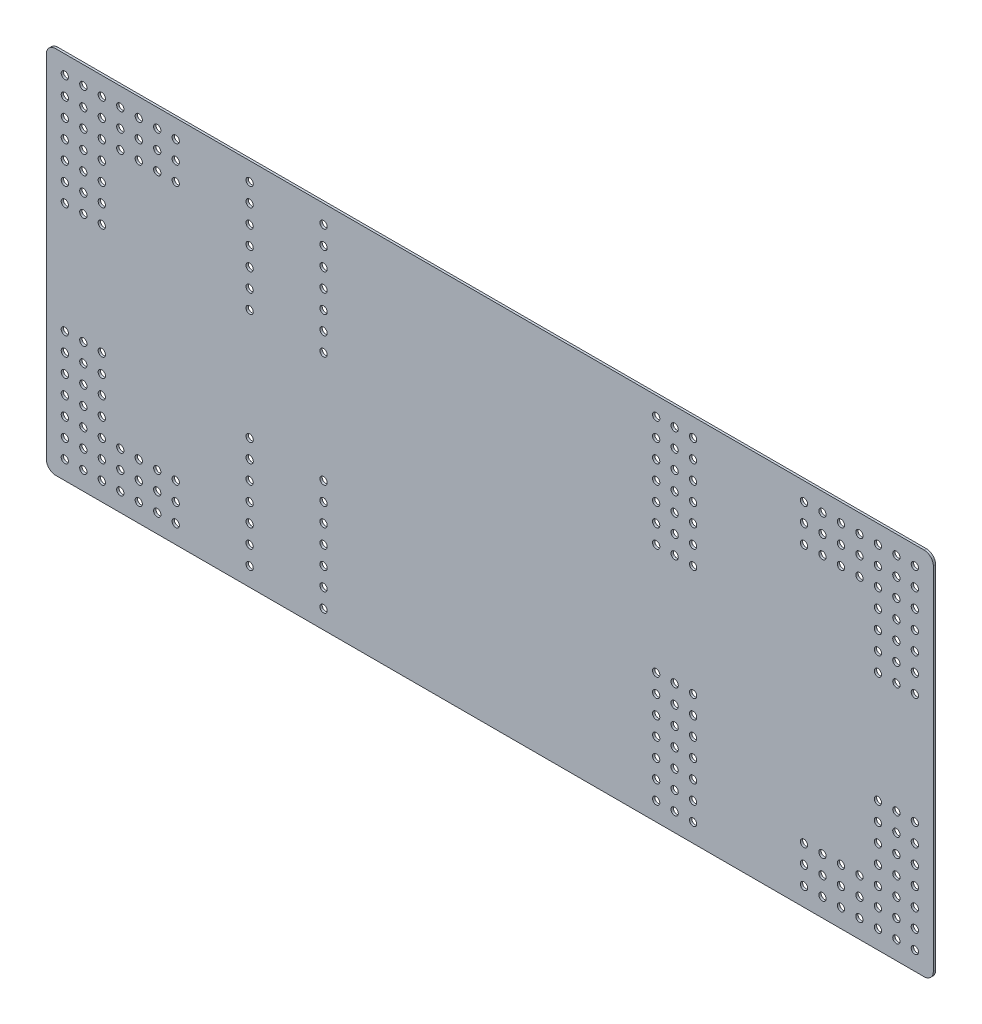
from build123d import *

# Parameters (mm, degrees)
BOSS_EXTRUDE1_DEPTH = 1.5875
SKETCH2_R           = 2.5
CUT_EXTRUDE1_DEPTH  = 474.010623106


with BuildPart() as part:
    # Sketch1 → Boss-Extrude1 (new body)
    with BuildSketch(Plane.XY):
        with BuildLine():
            Line((-148.965673289, 122.233995585), (447.934326711, 122.233995585))
            ThreePointArc((447.934326711, 122.233995585), (452.424454771, 120.374123646), (454.284326711, 115.883995585))
            Line((454.284326711, 115.883995585), (454.284326711, -125.416004415))
            ThreePointArc((454.284326711, -125.416004415), (452.424454771, -129.906132476), (447.934326711, -131.766004415))
            Line((447.934326711, -131.766004415), (-148.965673289, -131.766004415))
            ThreePointArc((-148.965673289, -131.766004415), (-153.45580135, -129.906132476), (-155.315673289, -125.416004415))
            Line((-155.315673289, -125.416004415), (-155.315673289, 115.883995585))
            ThreePointArc((-155.315673289, 115.883995585), (-153.45580135, 120.374123646), (-148.965673289, 122.233995585))
        make_face()
    extrude(amount=BOSS_EXTRUDE1_DEPTH)

    # Sketch2 → Cut-Extrude1 (cut, through all)
    with BuildSketch(Plane.XY.offset(1.5875)):
        with Locations((-142.615673289, 109.533995585)):
            Circle(SKETCH2_R)
        with Locations((-129.915673289, 109.533995585)):
            Circle(SKETCH2_R)
        with Locations((-117.215673289, 109.533995585)):
            Circle(SKETCH2_R)
        with Locations((-104.515673289, 109.533995585)):
            Circle(SKETCH2_R)
        with Locations((-91.815673289, 109.533995585)):
            Circle(SKETCH2_R)
        with Locations((-79.115673289, 109.533995585)):
            Circle(SKETCH2_R)
        with Locations((-66.415673289, 109.533995585)):
            Circle(SKETCH2_R)
        with Locations((-129.915673289, 96.833995585)):
            Circle(SKETCH2_R)
        with Locations((-117.215673289, 96.833995585)):
            Circle(SKETCH2_R)
        with Locations((-104.515673289, 96.833995585)):
            Circle(SKETCH2_R)
        with Locations((-91.815673289, 96.833995585)):
            Circle(SKETCH2_R)
        with Locations((-79.115673289, 96.833995585)):
            Circle(SKETCH2_R)
        with Locations((-66.415673289, 96.833995585)):
            Circle(SKETCH2_R)
        with Locations((-129.915673289, 84.133995585)):
            Circle(SKETCH2_R)
        with Locations((-117.215673289, 84.133995585)):
            Circle(SKETCH2_R)
        with Locations((-104.515673289, 84.133995585)):
            Circle(SKETCH2_R)
        with Locations((-91.815673289, 84.133995585)):
            Circle(SKETCH2_R)
        with Locations((-79.115673289, 84.133995585)):
            Circle(SKETCH2_R)
        with Locations((-66.415673289, 84.133995585)):
            Circle(SKETCH2_R)
        with Locations((-142.615673289, 96.833995585)):
            Circle(SKETCH2_R)
        with Locations((-142.615673289, 84.133995585)):
            Circle(SKETCH2_R)
        with Locations((-142.615673289, 71.433995585)):
            Circle(SKETCH2_R)
        with Locations((-129.915673289, 71.433995585)):
            Circle(SKETCH2_R)
        with Locations((-117.215673289, 71.433995585)):
            Circle(SKETCH2_R)
        with Locations((-129.915673289, 58.733995585)):
            Circle(SKETCH2_R)
        with Locations((-117.215673289, 58.733995585)):
            Circle(SKETCH2_R)
        with Locations((-129.915673289, 46.033995585)):
            Circle(SKETCH2_R)
        with Locations((-117.215673289, 46.033995585)):
            Circle(SKETCH2_R)
        with Locations((-129.915673289, 33.333995585)):
            Circle(SKETCH2_R)
        with Locations((-117.215673289, 33.333995585)):
            Circle(SKETCH2_R)
        with Locations((-142.615673289, 58.733995585)):
            Circle(SKETCH2_R)
        with Locations((-142.615673289, 46.033995585)):
            Circle(SKETCH2_R)
        with Locations((-142.615673289, 33.333995585)):
            Circle(SKETCH2_R)
        with Locations((-142.615673289, -42.866004415)):
            Circle(SKETCH2_R)
        with Locations((-142.615673289, -55.566004415)):
            Circle(SKETCH2_R)
        with Locations((-142.615673289, -68.266004415)):
            Circle(SKETCH2_R)
        with Locations((-117.215673289, -42.866004415)):
            Circle(SKETCH2_R)
        with Locations((-129.915673289, -42.866004415)):
            Circle(SKETCH2_R)
        with Locations((-117.215673289, -55.566004415)):
            Circle(SKETCH2_R)
        with Locations((-129.915673289, -55.566004415)):
            Circle(SKETCH2_R)
        with Locations((-117.215673289, -68.266004415)):
            Circle(SKETCH2_R)
        with Locations((-129.915673289, -68.266004415)):
            Circle(SKETCH2_R)
        with Locations((-117.215673289, -80.966004415)):
            Circle(SKETCH2_R)
        with Locations((-129.915673289, -80.966004415)):
            Circle(SKETCH2_R)
        with Locations((-142.615673289, -80.966004415)):
            Circle(SKETCH2_R)
        with Locations((-142.615673289, -93.666004415)):
            Circle(SKETCH2_R)
        with Locations((-142.615673289, -106.366004415)):
            Circle(SKETCH2_R)
        with Locations((-66.415673289, -93.666004415)):
            Circle(SKETCH2_R)
        with Locations((-79.115673289, -93.666004415)):
            Circle(SKETCH2_R)
        with Locations((-91.815673289, -93.666004415)):
            Circle(SKETCH2_R)
        with Locations((-104.515673289, -93.666004415)):
            Circle(SKETCH2_R)
        with Locations((-117.215673289, -93.666004415)):
            Circle(SKETCH2_R)
        with Locations((-129.915673289, -93.666004415)):
            Circle(SKETCH2_R)
        with Locations((-66.415673289, -106.366004415)):
            Circle(SKETCH2_R)
        with Locations((-79.115673289, -106.366004415)):
            Circle(SKETCH2_R)
        with Locations((-91.815673289, -106.366004415)):
            Circle(SKETCH2_R)
        with Locations((-104.515673289, -106.366004415)):
            Circle(SKETCH2_R)
        with Locations((-117.215673289, -106.366004415)):
            Circle(SKETCH2_R)
        with Locations((-129.915673289, -106.366004415)):
            Circle(SKETCH2_R)
        with Locations((-66.415673289, -119.066004415)):
            Circle(SKETCH2_R)
        with Locations((-79.115673289, -119.066004415)):
            Circle(SKETCH2_R)
        with Locations((-91.815673289, -119.066004415)):
            Circle(SKETCH2_R)
        with Locations((-104.515673289, -119.066004415)):
            Circle(SKETCH2_R)
        with Locations((-117.215673289, -119.066004415)):
            Circle(SKETCH2_R)
        with Locations((-129.915673289, -119.066004415)):
            Circle(SKETCH2_R)
        with Locations((-142.615673289, -119.066004415)):
            Circle(SKETCH2_R)
        with Locations((441.584326711, -119.066004415)):
            Circle(SKETCH2_R)
        with Locations((428.884326711, -119.066004415)):
            Circle(SKETCH2_R)
        with Locations((416.184326711, -119.066004415)):
            Circle(SKETCH2_R)
        with Locations((403.484326711, -119.066004415)):
            Circle(SKETCH2_R)
        with Locations((390.784326711, -119.066004415)):
            Circle(SKETCH2_R)
        with Locations((378.084326711, -119.066004415)):
            Circle(SKETCH2_R)
        with Locations((365.384326711, -119.066004415)):
            Circle(SKETCH2_R)
        with Locations((428.884326711, -106.366004415)):
            Circle(SKETCH2_R)
        with Locations((416.184326711, -106.366004415)):
            Circle(SKETCH2_R)
        with Locations((403.484326711, -106.366004415)):
            Circle(SKETCH2_R)
        with Locations((390.784326711, -106.366004415)):
            Circle(SKETCH2_R)
        with Locations((378.084326711, -106.366004415)):
            Circle(SKETCH2_R)
        with Locations((365.384326711, -106.366004415)):
            Circle(SKETCH2_R)
        with Locations((428.884326711, -93.666004415)):
            Circle(SKETCH2_R)
        with Locations((416.184326711, -93.666004415)):
            Circle(SKETCH2_R)
        with Locations((403.484326711, -93.666004415)):
            Circle(SKETCH2_R)
        with Locations((390.784326711, -93.666004415)):
            Circle(SKETCH2_R)
        with Locations((378.084326711, -93.666004415)):
            Circle(SKETCH2_R)
        with Locations((365.384326711, -93.666004415)):
            Circle(SKETCH2_R)
        with Locations((441.584326711, -106.366004415)):
            Circle(SKETCH2_R)
        with Locations((441.584326711, -93.666004415)):
            Circle(SKETCH2_R)
        with Locations((441.584326711, -80.966004415)):
            Circle(SKETCH2_R)
        with Locations((428.884326711, -80.966004415)):
            Circle(SKETCH2_R)
        with Locations((416.184326711, -80.966004415)):
            Circle(SKETCH2_R)
        with Locations((428.884326711, -68.266004415)):
            Circle(SKETCH2_R)
        with Locations((416.184326711, -68.266004415)):
            Circle(SKETCH2_R)
        with Locations((428.884326711, -55.566004415)):
            Circle(SKETCH2_R)
        with Locations((416.184326711, -55.566004415)):
            Circle(SKETCH2_R)
        with Locations((428.884326711, -42.866004415)):
            Circle(SKETCH2_R)
        with Locations((416.184326711, -42.866004415)):
            Circle(SKETCH2_R)
        with Locations((441.584326711, -68.266004415)):
            Circle(SKETCH2_R)
        with Locations((441.584326711, -55.566004415)):
            Circle(SKETCH2_R)
        with Locations((441.584326711, -42.866004415)):
            Circle(SKETCH2_R)
        with Locations((441.584326711, 33.333995585)):
            Circle(SKETCH2_R)
        with Locations((441.584326711, 46.033995585)):
            Circle(SKETCH2_R)
        with Locations((441.584326711, 58.733995585)):
            Circle(SKETCH2_R)
        with Locations((416.184326711, 33.333995585)):
            Circle(SKETCH2_R)
        with Locations((428.884326711, 33.333995585)):
            Circle(SKETCH2_R)
        with Locations((416.184326711, 46.033995585)):
            Circle(SKETCH2_R)
        with Locations((428.884326711, 46.033995585)):
            Circle(SKETCH2_R)
        with Locations((416.184326711, 58.733995585)):
            Circle(SKETCH2_R)
        with Locations((428.884326711, 58.733995585)):
            Circle(SKETCH2_R)
        with Locations((416.184326711, 71.433995585)):
            Circle(SKETCH2_R)
        with Locations((428.884326711, 71.433995585)):
            Circle(SKETCH2_R)
        with Locations((441.584326711, 71.433995585)):
            Circle(SKETCH2_R)
        with Locations((441.584326711, 84.133995585)):
            Circle(SKETCH2_R)
        with Locations((441.584326711, 96.833995585)):
            Circle(SKETCH2_R)
        with Locations((365.384326711, 84.133995585)):
            Circle(SKETCH2_R)
        with Locations((378.084326711, 84.133995585)):
            Circle(SKETCH2_R)
        with Locations((390.784326711, 84.133995585)):
            Circle(SKETCH2_R)
        with Locations((403.484326711, 84.133995585)):
            Circle(SKETCH2_R)
        with Locations((416.184326711, 84.133995585)):
            Circle(SKETCH2_R)
        with Locations((428.884326711, 84.133995585)):
            Circle(SKETCH2_R)
        with Locations((365.384326711, 96.833995585)):
            Circle(SKETCH2_R)
        with Locations((378.084326711, 96.833995585)):
            Circle(SKETCH2_R)
        with Locations((390.784326711, 96.833995585)):
            Circle(SKETCH2_R)
        with Locations((403.484326711, 96.833995585)):
            Circle(SKETCH2_R)
        with Locations((416.184326711, 96.833995585)):
            Circle(SKETCH2_R)
        with Locations((428.884326711, 96.833995585)):
            Circle(SKETCH2_R)
        with Locations((365.384326711, 109.533995585)):
            Circle(SKETCH2_R)
        with Locations((378.084326711, 109.533995585)):
            Circle(SKETCH2_R)
        with Locations((390.784326711, 109.533995585)):
            Circle(SKETCH2_R)
        with Locations((403.484326711, 109.533995585)):
            Circle(SKETCH2_R)
        with Locations((416.184326711, 109.533995585)):
            Circle(SKETCH2_R)
        with Locations((428.884326711, 109.533995585)):
            Circle(SKETCH2_R)
        with Locations((441.584326711, 109.533995585)):
            Circle(SKETCH2_R)
        with Locations((-15.615673289, 109.533995585)):
            Circle(SKETCH2_R)
        with Locations((35.184326711, 109.533995585)):
            Circle(SKETCH2_R)
        with Locations((-15.615673289, 96.833995585)):
            Circle(SKETCH2_R)
        with Locations((35.184326711, 96.833995585)):
            Circle(SKETCH2_R)
        with Locations((-15.615673289, 84.133995585)):
            Circle(SKETCH2_R)
        with Locations((35.184326711, 84.133995585)):
            Circle(SKETCH2_R)
        with Locations((-15.615673289, 71.433995585)):
            Circle(SKETCH2_R)
        with Locations((35.184326711, 71.433995585)):
            Circle(SKETCH2_R)
        with Locations((-15.615673289, 58.733995585)):
            Circle(SKETCH2_R)
        with Locations((35.184326711, 58.733995585)):
            Circle(SKETCH2_R)
        with Locations((-15.615673289, 46.033995585)):
            Circle(SKETCH2_R)
        with Locations((35.184326711, 46.033995585)):
            Circle(SKETCH2_R)
        with Locations((-15.615673289, 33.333995585)):
            Circle(SKETCH2_R)
        with Locations((35.184326711, 33.333995585)):
            Circle(SKETCH2_R)
        with Locations((35.184326711, -42.866004415)):
            Circle(SKETCH2_R)
        with Locations((-15.615673289, -42.866004415)):
            Circle(SKETCH2_R)
        with Locations((35.184326711, -55.566004415)):
            Circle(SKETCH2_R)
        with Locations((-15.615673289, -55.566004415)):
            Circle(SKETCH2_R)
        with Locations((35.184326711, -68.266004415)):
            Circle(SKETCH2_R)
        with Locations((-15.615673289, -68.266004415)):
            Circle(SKETCH2_R)
        with Locations((35.184326711, -80.966004415)):
            Circle(SKETCH2_R)
        with Locations((-15.615673289, -80.966004415)):
            Circle(SKETCH2_R)
        with Locations((35.184326711, -93.666004415)):
            Circle(SKETCH2_R)
        with Locations((-15.615673289, -93.666004415)):
            Circle(SKETCH2_R)
        with Locations((35.184326711, -106.366004415)):
            Circle(SKETCH2_R)
        with Locations((-15.615673289, -106.366004415)):
            Circle(SKETCH2_R)
        with Locations((35.184326711, -119.066004415)):
            Circle(SKETCH2_R)
        with Locations((-15.615673289, -119.066004415)):
            Circle(SKETCH2_R)
        with Locations((289.184326711, 109.533995585)):
            Circle(SKETCH2_R)
        with Locations((276.484326711, 109.533995585)):
            Circle(SKETCH2_R)
        with Locations((263.784326711, 109.533995585)):
            Circle(SKETCH2_R)
        with Locations((276.484326711, 96.833995585)):
            Circle(SKETCH2_R)
        with Locations((263.784326711, 96.833995585)):
            Circle(SKETCH2_R)
        with Locations((276.484326711, 84.133995585)):
            Circle(SKETCH2_R)
        with Locations((263.784326711, 84.133995585)):
            Circle(SKETCH2_R)
        with Locations((276.484326711, 71.433995585)):
            Circle(SKETCH2_R)
        with Locations((263.784326711, 71.433995585)):
            Circle(SKETCH2_R)
        with Locations((276.484326711, 58.733995585)):
            Circle(SKETCH2_R)
        with Locations((263.784326711, 58.733995585)):
            Circle(SKETCH2_R)
        with Locations((276.484326711, 46.033995585)):
            Circle(SKETCH2_R)
        with Locations((263.784326711, 46.033995585)):
            Circle(SKETCH2_R)
        with Locations((276.484326711, 33.333995585)):
            Circle(SKETCH2_R)
        with Locations((263.784326711, 33.333995585)):
            Circle(SKETCH2_R)
        with Locations((289.184326711, 96.833995585)):
            Circle(SKETCH2_R)
        with Locations((289.184326711, 84.133995585)):
            Circle(SKETCH2_R)
        with Locations((289.184326711, 71.433995585)):
            Circle(SKETCH2_R)
        with Locations((289.184326711, 58.733995585)):
            Circle(SKETCH2_R)
        with Locations((289.184326711, 46.033995585)):
            Circle(SKETCH2_R)
        with Locations((289.184326711, 33.333995585)):
            Circle(SKETCH2_R)
        with Locations((289.184326711, -42.866004415)):
            Circle(SKETCH2_R)
        with Locations((289.184326711, -55.566004415)):
            Circle(SKETCH2_R)
        with Locations((289.184326711, -68.266004415)):
            Circle(SKETCH2_R)
        with Locations((289.184326711, -80.966004415)):
            Circle(SKETCH2_R)
        with Locations((289.184326711, -93.666004415)):
            Circle(SKETCH2_R)
        with Locations((289.184326711, -106.366004415)):
            Circle(SKETCH2_R)
        with Locations((263.784326711, -42.866004415)):
            Circle(SKETCH2_R)
        with Locations((276.484326711, -42.866004415)):
            Circle(SKETCH2_R)
        with Locations((263.784326711, -55.566004415)):
            Circle(SKETCH2_R)
        with Locations((276.484326711, -55.566004415)):
            Circle(SKETCH2_R)
        with Locations((263.784326711, -68.266004415)):
            Circle(SKETCH2_R)
        with Locations((276.484326711, -68.266004415)):
            Circle(SKETCH2_R)
        with Locations((263.784326711, -80.966004415)):
            Circle(SKETCH2_R)
        with Locations((276.484326711, -80.966004415)):
            Circle(SKETCH2_R)
        with Locations((263.784326711, -93.666004415)):
            Circle(SKETCH2_R)
        with Locations((276.484326711, -93.666004415)):
            Circle(SKETCH2_R)
        with Locations((263.784326711, -106.366004415)):
            Circle(SKETCH2_R)
        with Locations((276.484326711, -106.366004415)):
            Circle(SKETCH2_R)
        with Locations((263.784326711, -119.066004415)):
            Circle(SKETCH2_R)
        with Locations((276.484326711, -119.066004415)):
            Circle(SKETCH2_R)
        with Locations((289.184326711, -119.066004415)):
            Circle(SKETCH2_R)
    extrude(amount=-CUT_EXTRUDE1_DEPTH, mode=Mode.SUBTRACT)


solid = part.part
